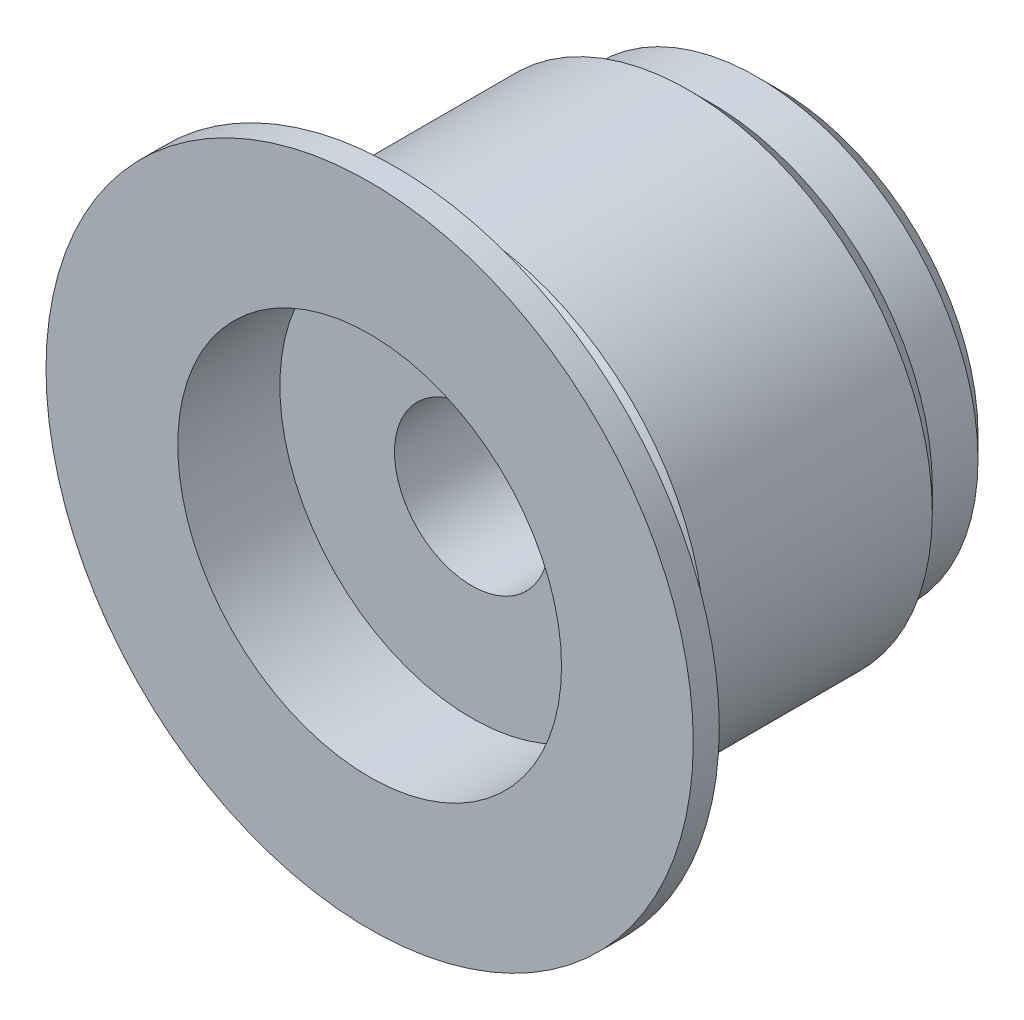
from build123d import *

# Parameters (mm, degrees)
SKETCH2_W          = 0.889
SKETCH2_H          = 5.090217297
CUT_EXTRUDE1_DEPTH = 0.254


with BuildPart() as part:
    # Sketch1 → Revolve1 (revolve)
    with BuildSketch(Plane(origin=(0, 0, 0), x_dir=(1, 0, 0), z_dir=(0, 1, 0))):
        Polygon((-12.6365, 0), (-12.6365, 1.016), (-8.961769376, 2.992769376), (-9.525, 3.556), (-9.525, 12.446), (-8.626974388, 13.344025612), (-8.626974388, 15.127727136), (-7.752701524, 16.002), (0, 16.002), (0, 14.766345842), (-3.01625, 12.954), (-3.01625, 3.9878), (-7.493, 3.9878), (-7.493, 0), align=None)
    revolve(axis=Axis((0, 0, 0), (0, 0, -1)))

    # Sketch2 → Cut-Extrude1 (cut)
    with BuildSketch(Plane(origin=(0, 0, -16.002), x_dir=(-1, 0, 0), z_dir=(0, 0, -1))):
        with Locations((0, -6.235620101)):
            Rectangle(SKETCH2_W, SKETCH2_H)
    extrude(amount=-CUT_EXTRUDE1_DEPTH, mode=Mode.SUBTRACT)


solid = part.part
